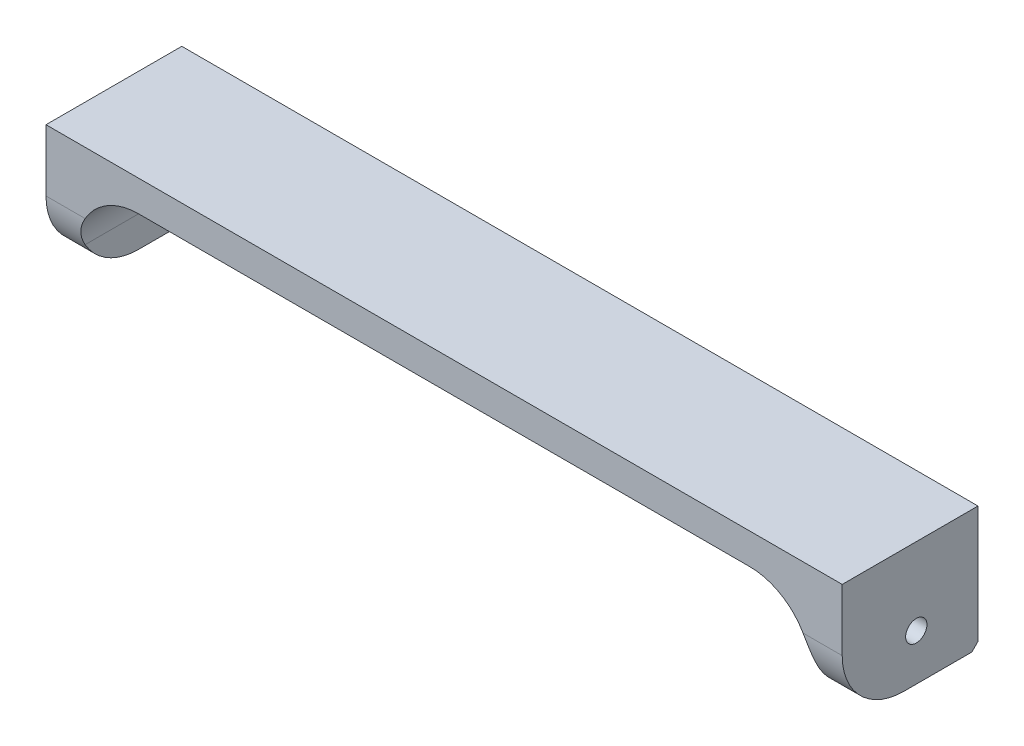
from build123d import *

# Parameters (mm, degrees)
BOSS_EXTRUDE1_DEPTH = 22
FILLET1_R           = 10
SKETCH2_R           = 1.725
CUT_EXTRUDE1_DEPTH  = 132.244047484
SKETCH3_R           = 2.8
CUT_EXTRUDE2_DEPTH  = 119
FILLET2_R           = 10
CHAMFER1_SIZE       = 1


with BuildPart() as part:
    # Sketch1 → Boss-Extrude1 (new body)
    with BuildSketch(Plane.XY):
        Polygon((-64.5, 10), (64.5, 10), (64.5, -10), (59.5, -10), (59.5, 5), (-59.5, 5), (-59.5, -10), (-64.5, -10), align=None)
    extrude(amount=BOSS_EXTRUDE1_DEPTH)

    # Fillet1
    fillet1_edges = [part.edges().sort_by_distance(p)[0] for p in [
        (-59.5, 5, 11),
        (59.5, 5, 11),
    ]]
    fillet(fillet1_edges, radius=FILLET1_R)

    # Sketch2 → Cut-Extrude1 (cut, through all)
    with BuildSketch(Plane(origin=(64.5, 0, 0), x_dir=(0, 0, -1), z_dir=(1, 0, 0))):
        with Locations((-10, -2.5)):
            Circle(SKETCH2_R)
    extrude(amount=-CUT_EXTRUDE1_DEPTH, mode=Mode.SUBTRACT)

    # Sketch3 → Cut-Extrude2 (cut)
    with BuildSketch(Plane.ZY.offset(-59.5)):
        with Locations((10, -2.5)):
            Circle(SKETCH3_R)
    extrude(amount=CUT_EXTRUDE2_DEPTH, mode=Mode.SUBTRACT)

    # Fillet2
    # the kernel refuses this fillet: 10 mm, written as the material it takes off along each edge
    with BuildSketch(Plane(origin=(89.5, -10, 22), x_dir=(0, 1, 0), z_dir=(-1, 0, 0))) as fillet2_piece_1:
        with BuildLine():
            CenterArc((FILLET2_R, FILLET2_R), FILLET2_R, 180, 90)
            Line((0, FILLET2_R), (0, 0))
            Line((0, 0), (FILLET2_R, 0))
        make_face()
    extrude(amount=55, mode=Mode.SUBTRACT)
    with BuildSketch(Plane(origin=(-34.5, -10, 22), x_dir=(0, 0, -1), z_dir=(-1, 0, 0))) as fillet2_piece_2:
        with BuildLine():
            CenterArc((FILLET2_R, -FILLET2_R), FILLET2_R, 90, 90)
            Line((0, -FILLET2_R), (0, 0))
            Line((0, 0), (FILLET2_R, 0))
        make_face()
    extrude(amount=55, mode=Mode.SUBTRACT)

    # Chamfer1
    chamfer1_edges = [part.edges().sort_by_distance(p)[0] for p in [
        (62, -10, 0),
        (-62, -10, 0),
    ]]
    chamfer(chamfer1_edges, length=CHAMFER1_SIZE)


solid = part.part
